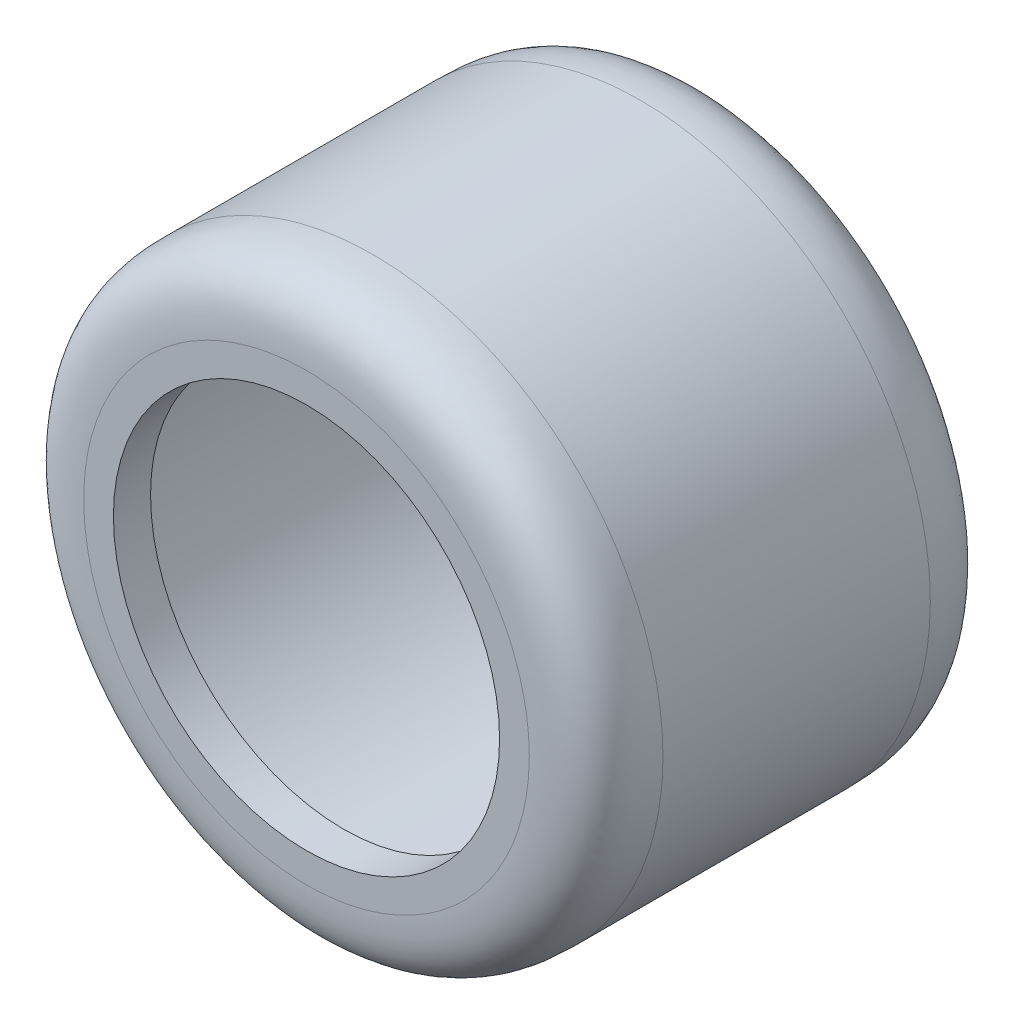
from build123d import *

# Parameters (mm, degrees)
ESQUISSE1_R             = 78
BOSS_EXTRU_1_DEPTH      = 108
ENL_V_MAT_EXTRU_1_REACH = 185.059
ESQUISSE2_R             = 6.35
ESQUISSE3_R             = 52
ENL_V_MAT_EXTRU_2_DEPTH = 184.059066517
CONG_1_SIZE             = 18
COQUE2_T                = -10


with BuildPart() as part:
    # Esquisse1 → Boss.-Extru.1 (new body)
    with BuildSketch(Plane.XY):
        with Locations((-24.541152766, 28.451556229)):
            Circle(ESQUISSE1_R)
    extrude(amount=BOSS_EXTRU_1_DEPTH)

    # Esquisse2 → Enlèv. mat.-Extru.1 (cut, up to next)
    with BuildSketch(Plane.XY.offset(108), mode=Mode.PRIVATE) as enl_v_mat_extru_1_sk1:
        with Locations((-24.541152766, 28.451556229)):
            Circle(ESQUISSE2_R)
    enl_v_mat_extru_1_tool1 = extrude(enl_v_mat_extru_1_sk1.sketch, amount=-ENL_V_MAT_EXTRU_1_REACH, mode=Mode.PRIVATE) & part.part
    add(enl_v_mat_extru_1_tool1.solids().sort_by_distance((-24.541153, 28.451556, 108))[0], mode=Mode.SUBTRACT)

    # Esquisse3 → Enlèv. mat.-Extru.2 (cut, through all)
    with BuildSketch(Plane.XY.offset(108)):
        with Locations((-24.541152766, 28.451556229)):
            Circle(ESQUISSE3_R)
    extrude(amount=-ENL_V_MAT_EXTRU_2_DEPTH, mode=Mode.SUBTRACT)

    # Congé1
    # a fillet whose section is not a circle: 18 mm, written as the material it takes off along each edge
    with BuildSketch(Plane(origin=(-24.541152766, 28.451556229, 0), x_dir=(1, 0, 0), z_dir=(0, -1, 0))) as cong_1_piece_1:
        with BuildLine():
            add(Edge.make_bspline([(78, CONG_1_SIZE), (78, CONG_1_SIZE * 0.831801948466), (78, CONG_1_SIZE * 0.663603896932), (78 - CONG_1_SIZE * 0.0716919198361, CONG_1_SIZE * 0.292893218813), (78 - CONG_1_SIZE * 0.292893218813, CONG_1_SIZE * 0.0716919198361), (78 - CONG_1_SIZE * 0.663603896932, 0), (78 - CONG_1_SIZE * 0.831801948466, 0), (78 - CONG_1_SIZE, 0)], knots=[0, 0, 0, 0, 0, 0, 0.5, 0.5, 1, 1, 1, 1, 1, 1], degree=5))
            Line((78 - CONG_1_SIZE, 0), (78, 0))
            Line((78, 0), (78, CONG_1_SIZE))
        make_face()
    revolve(axis=Axis((-24.541152766, 28.451556229, 0), (0, 0, 1)), mode=Mode.SUBTRACT)
    with BuildSketch(Plane(origin=(-24.541152766, 28.451556229, 108), x_dir=(1, 0, 0), z_dir=(0, -1, 0))) as cong_1_piece_2:
        with BuildLine():
            add(Edge.make_bspline([(78, -CONG_1_SIZE), (78, -CONG_1_SIZE * 0.831801948466), (78, -CONG_1_SIZE * 0.663603896932), (78 - CONG_1_SIZE * 0.0716919198361, -CONG_1_SIZE * 0.292893218813), (78 - CONG_1_SIZE * 0.292893218813, -CONG_1_SIZE * 0.0716919198361), (78 - CONG_1_SIZE * 0.663603896932, 0), (78 - CONG_1_SIZE * 0.831801948466, 0), (78 - CONG_1_SIZE, 0)], knots=[0, 0, 0, 0, 0, 0, 0.5, 0.5, 1, 1, 1, 1, 1, 1], degree=5))
            Line((78 - CONG_1_SIZE, 0), (78, 0))
            Line((78, 0), (78, -CONG_1_SIZE))
        make_face()
    revolve(axis=Axis((-24.541152766, 28.451556229, 108), (0, 0, 1)), mode=Mode.SUBTRACT)

    # Coque2
    coque2_openings = [part.faces().sort_by_distance(p)[0] for p in [
        (-76.541152766, 28.451556229, 54),
    ]]
    offset(amount=COQUE2_T, openings=coque2_openings, kind=Kind.INTERSECTION)


solid = part.part
